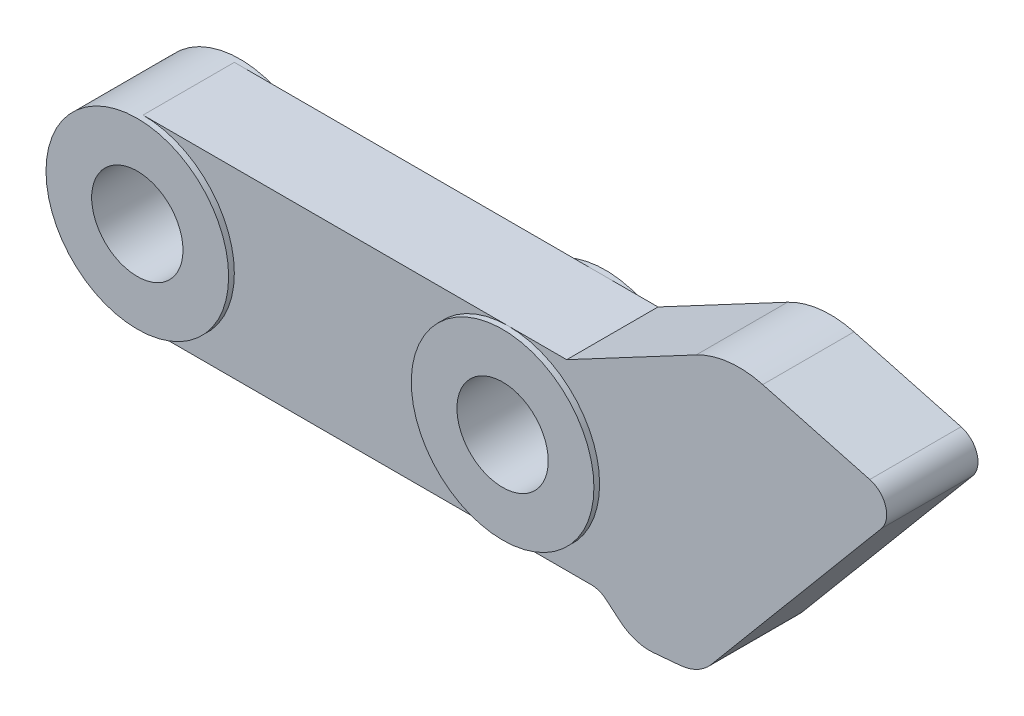
from build123d import *

# Parameters (mm, degrees)
BOSS_EXTRUDE1_DEPTH = 6.35
FILLET1_R           = 6.35
SKETCH2_R           = 3.175
CUT_EXTRUDE1_DEPTH  = 6.35
BOSS_EXTRUDE2_START = 0.396875
SKETCH3_R           = 6.35
SKETCH3_R_2         = 3.175
BOSS_EXTRUDE2_DEPTH = 0.396875
SKETCH4_R           = 6.35
SKETCH4_R_2         = 3.175
BOSS_EXTRUDE3_DEPTH = 0.396875
FILLET2_R           = 1.5875
CHAMFER1_SIZE       = 3.175
FILLET3_R           = 3.175


with BuildPart() as part:
    # Sketch1 → Boss-Extrude1 (new body)
    with BuildSketch(Plane.XY):
        Polygon((0, 0), (38.1, 0), (42.964382214, -4.081701322), (59.2911875, 15.375827534), (47.023929506, 18.662829407), (35.810782514, 12.7), (0, 12.7), align=None)
    extrude(amount=BOSS_EXTRUDE1_DEPTH)

    # Fillet1
    fillet1_edges = [part.edges().sort_by_distance(p)[0] for p in [
        (47.023929506, 18.662829407, 3.175),
        (0, 0, 3.175),
        (0, 12.7, 3.175),
    ]]
    fillet(fillet1_edges, radius=FILLET1_R - 0.0001)  # a hair under: the kernel refuses the full size

    # Sketch2 → Cut-Extrude1 (cut)
    with BuildSketch(Plane.XY.offset(6.35)):
        with Locations((6.35, 6.35)):
            Circle(SKETCH2_R)
        with Locations((31.75, 6.35)):
            Circle(SKETCH2_R)
    extrude(amount=-CUT_EXTRUDE1_DEPTH, mode=Mode.SUBTRACT)

    # Sketch3 → Boss-Extrude2 (add)
    # profile 1 of 2: a face of its own
    with BuildSketch(Plane.XY.offset(6.35).offset(BOSS_EXTRUDE2_START)):
        with Locations(Location((31.75, 6.35, 0), (0, 0, 270))):
            Circle(SKETCH3_R)
        with Locations((31.75, 6.35)):
            Circle(SKETCH3_R_2, mode=Mode.SUBTRACT)
    # profile 2 of 2: a face of its own
    with BuildSketch(Plane.XY.offset(6.35).offset(BOSS_EXTRUDE2_START)):
        with Locations(Location((6.35, 6.35, 0), (0, 0, 180))):
            Circle(SKETCH3_R)
        with Locations((6.35, 6.35)):
            Circle(SKETCH3_R_2, mode=Mode.SUBTRACT)
    extrude(amount=-BOSS_EXTRUDE2_DEPTH)

    # Sketch4 → Boss-Extrude3 (add)
    # profile 1 of 2: a face of its own
    with BuildSketch(Plane(origin=(0, 0, 0), x_dir=(-1, 0, 0), z_dir=(0, 0, -1))):
        with Locations(Location((-31.75, 6.35, 0), (0, 0, 270))):
            Circle(SKETCH4_R)
        with Locations(Location((-31.75, 6.35, 0), (0, 0, 180))):
            Circle(SKETCH4_R_2, mode=Mode.SUBTRACT)
    # profile 2 of 2: a face of its own
    with BuildSketch(Plane(origin=(0, 0, 0), x_dir=(-1, 0, 0), z_dir=(0, 0, -1))):
        with Locations((-6.35, 6.35)):
            Circle(SKETCH4_R)
        with Locations(Location((-6.35, 6.35, 0), (0, 0, 180))):
            Circle(SKETCH4_R_2, mode=Mode.SUBTRACT)
    extrude(amount=BOSS_EXTRUDE3_DEPTH)

    # Fillet2
    fillet2_edges = [part.edges().sort_by_distance(p)[0] for p in [
        (59.2911875, 15.375827534, 3.175),
        (38.1, 0, 3.175),
    ]]
    fillet(fillet2_edges, radius=FILLET2_R)

    # Chamfer1
    chamfer1_edges = [part.edges().sort_by_distance(p)[0] for p in [
        (42.964382214, -4.081701322, 3.175),
    ]]
    chamfer(chamfer1_edges, length=CHAMFER1_SIZE)

    # Fillet3
    fillet3_edges = [part.edges().sort_by_distance(p)[0] for p in [
        (45.005232875, -1.649510215, 3.175),
        (40.532191107, -2.040850661, 3.175),
    ]]
    fillet(fillet3_edges, radius=FILLET3_R)


solid = part.part
